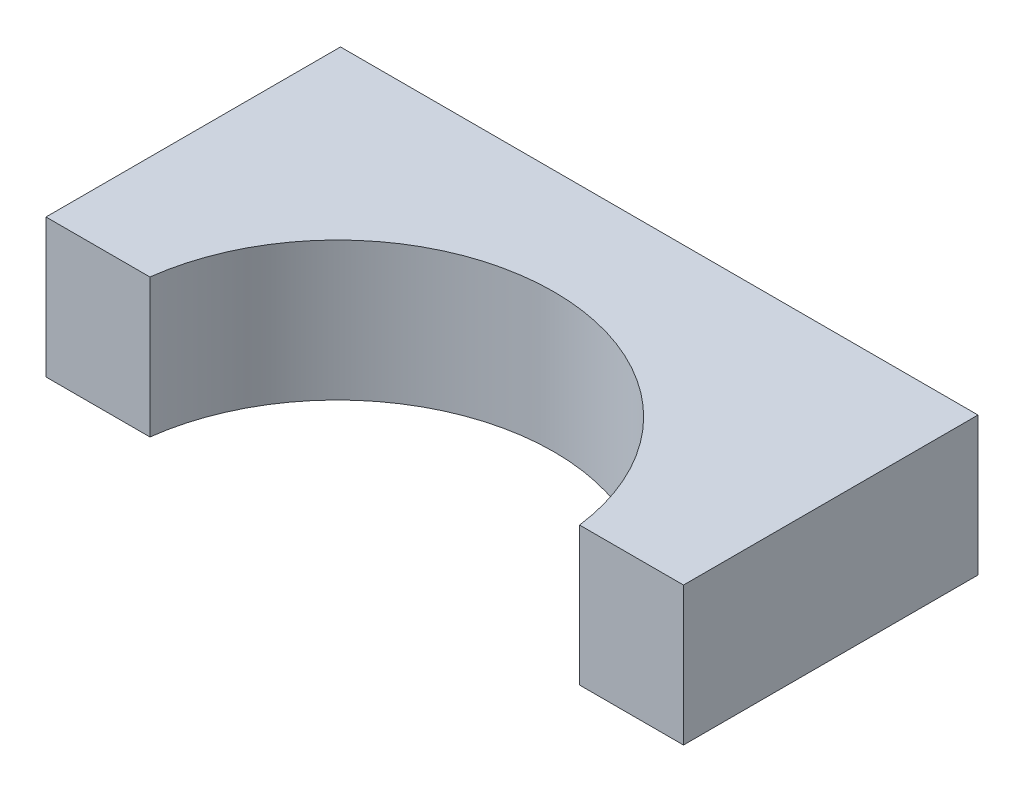
from build123d import *

# Parameters (mm, degrees)
BOSS_EXTRUDE1_DEPTH = 10.16
SKETCH6_R           = 1.0033
CUT_EXTRUDE1_DEPTH  = 4.064


with BuildPart() as part:
    # Sketch2 → Boss-Extrude1 (new body)
    with BuildSketch(Plane(origin=(0, 0, 0), x_dir=(1, 0, 0), z_dir=(0, 1, 0))):
        with BuildLine():
            Line((-14.986, -8.89), (-7.366, -8.89))
            ThreePointArc((-7.366, -8.89), (8.382, 4.980973803), (24.13, -8.89))
            Line((24.13, -8.89), (31.75, -8.89))
            Line((31.75, -8.89), (31.75, 12.7))
            Line((31.75, 12.7), (-14.986, 12.7))
            Line((-14.986, 12.7), (-14.986, -8.89))
        make_face()
    extrude(amount=-BOSS_EXTRUDE1_DEPTH)

    # Sketch6 → Cut-Extrude1 (cut)
    with BuildSketch(Plane(origin=(0, 0, -12.7), x_dir=(-1, 0, 0), z_dir=(0, 0, -1))):
        with Locations((10.16, -5.08)):
            Circle(SKETCH6_R)
        with Locations((-26.924, -5.08)):
            Circle(SKETCH6_R)
    extrude(amount=-CUT_EXTRUDE1_DEPTH, mode=Mode.SUBTRACT)


solid = part.part
